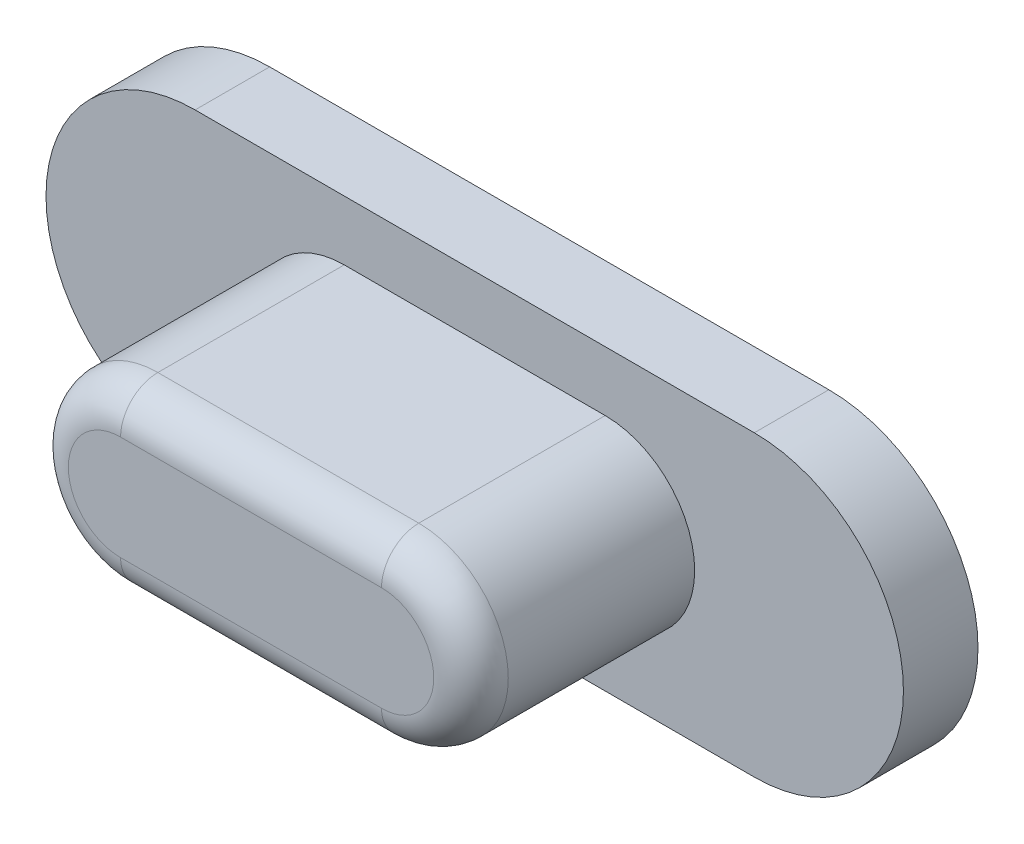
from build123d import *

# Parameters (mm, degrees)
EXTRUDE_1_DEPTH = 3
EXTRUDE_2_DEPTH = 1
FILLET_1_R      = 0.5


with BuildPart() as part:
    # 草图1 → 凸台-拉伸1 (new body)
    with BuildSketch(Plane.XY):
        with BuildLine():
            Line((1.25, 2.45), (4.75, 2.45))
            ThreePointArc((4.75, 2.45), (5.95, 1.25), (4.75, 0.05))
            Line((4.75, 0.05), (1.25, 0.05))
            ThreePointArc((1.25, 0.05), (0.05, 1.25), (1.25, 2.45))
        make_face()
    extrude(amount=EXTRUDE_1_DEPTH)

    # 草图2 → 凸台-拉伸2 (add)
    with BuildSketch(Plane(origin=(0, 0, 0), x_dir=(-1, 0, 0), z_dir=(0, 0, -1))):
        with BuildLine():
            Line((-6.75, -0.75), (0.75, -0.75))
            ThreePointArc((0.75, -0.75), (2.75, 1.25), (0.75, 3.25))
            Line((0.75, 3.25), (-6.75, 3.25))
            ThreePointArc((-6.75, 3.25), (-8.75, 1.25), (-6.75, -0.75))
        make_face()
    extrude(amount=EXTRUDE_2_DEPTH)

    # 圆角1
    fillet_1_edges = [part.edges().sort_by_distance(p)[0] for p in [
        (0.05, 1.25, 3),
        (3, 0.05, 3),
        (5.95, 1.25, 3),
        (3, 2.45, 3),
    ]]
    fillet(fillet_1_edges, radius=FILLET_1_R)


solid = part.part
